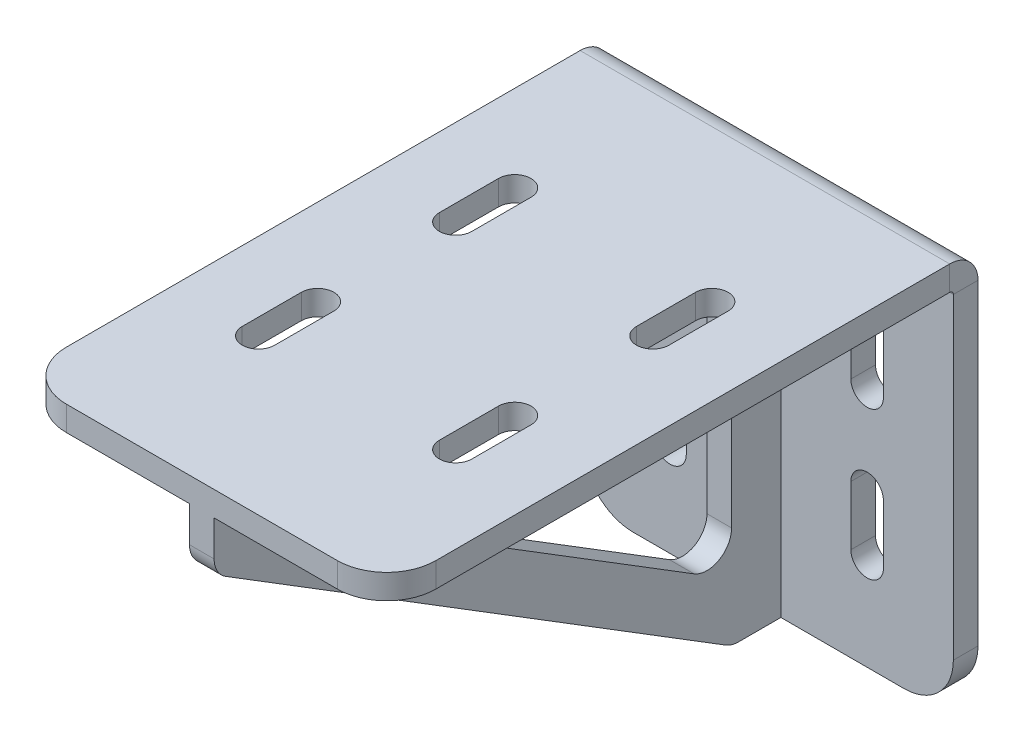
from build123d import *

# Parameters (mm, degrees)
SKETCH_1_W                       = 75
SKETCH_1_H                       = 80
SM_BASE_FLANGE_1_DEPTH           = 5
SM_EDGE_FLANGE_1_STRIP_W         = 21.4732
SM_EDGE_FLANGE_1_STRIP_H         = 5
SM_EDGE_FLANGE_1_STRIP_CUT_DEPTH = 75
SM_EDGE_FLANGE_1_DEPTH           = 75
EXTRUDE_1_DEPTH                  = 2.5
CUT_EXTRUDE_1_DEPTH              = 129.16005618
FILLET_1_R                       = 5
FILLET_2_R                       = 10
CUT_EXTRUDE_2_DEPTH              = 128.401923062
CUT_EXTRUDE_3_DEPTH              = 143.324453275


# Sheet-metal steps are written as plain solids
with BuildPart() as part:
    # Sketch 1 → 基体-法兰1 (new body)
    with BuildSketch(Plane.XY):
        Rectangle(SKETCH_1_W, SKETCH_1_H)
    extrude(amount=-SM_BASE_FLANGE_1_DEPTH)

    # 边线-法兰1 strip (across the edge) → 边线-法兰1 strip cut (cut)
    with BuildSketch(Plane(origin=(37.5, 40, 0), x_dir=(0, -1, 0), z_dir=(-1, 0, 0))):
        with Locations((-5, -2.5)):
            Rectangle(SM_EDGE_FLANGE_1_STRIP_W, SM_EDGE_FLANGE_1_STRIP_H)
    extrude(amount=SM_EDGE_FLANGE_1_STRIP_CUT_DEPTH, mode=Mode.SUBTRACT)

    # 边线-法兰1 section (across the edge) → 边线-法兰1 (add)
    with BuildSketch(Plane(origin=(37.5, 40, 0), x_dir=(0, -1, 0), z_dir=(-1, 0, 0))):
        with BuildLine():
            Line((0, 0.7366), (0, 115))
            Line((0, 115), (5, 115))
            Line((5, 115), (5, 0.7366))
            ThreePointArc((5, 0.7366), (5.215745145, 0.215745145), (5.7366, 0))
            Line((5.7366, 0), (5.7366, -5))
            ThreePointArc((5.7366, -5), (1.680211239, -3.319788761), (0, 0.7366))
        make_face()
    extrude(amount=SM_EDGE_FLANGE_1_DEPTH)

    # 草图9 → 凸台-拉伸1 (add, symmetric)
    with BuildSketch(Plane(origin=(0, 0, 0), x_dir=(0, 0, -1), z_dir=(1, 0, 0))):
        with BuildLine():
            Line((-115, 35), (-115, 25))
            Line((-115, 25), (-10, -40))
            Line((-10, -40), (0, -40))
            Line((0, -40), (0, 34.2634))
            ThreePointArc((0, 34.2634), (-0.215745145, 34.784254855), (-0.7366, 35))
            Line((-0.7366, 35), (-115, 35))
        make_face()
    extrude(amount=EXTRUDE_1_DEPTH, both=True)

    # 草图10 → 切除-拉伸1 (cut, through all)
    with BuildSketch(Plane(origin=(2.5, 0, 0), x_dir=(0, 0, -1), z_dir=(1, 0, 0))):
        Polygon((-10, 25), (-96.001401484, 25), (-10, -28.238962824), align=None)
    extrude(amount=-CUT_EXTRUDE_1_DEPTH, mode=Mode.SUBTRACT)

    # 圆角1
    fillet_1_edges = [part.edges().sort_by_distance(p)[0] for p in [
        (0, 25, 115),
        (0, -40, 10),
        (0, 25, 10),
        (0, -28.238962824, 10),
        (0, 25, 96.001401484),
    ]]
    fillet(fillet_1_edges, radius=FILLET_1_R)

    # 圆角2
    fillet_2_edges = [part.edges().sort_by_distance(p)[0] for p in [
        (37.5, 37.5, 115),
        (-37.5, 37.5, 115),
        (37.5, -40, -2.5),
        (-37.5, -40, -2.5),
    ]]
    fillet(fillet_2_edges, radius=FILLET_2_R)

    # 草图11 → 切除-拉伸2 (cut, through all)
    with BuildSketch(Plane.XY):
        with BuildLine():
            Line((-16.7, -9), (-16.7, -21))
            ThreePointArc((-16.7, -21), (-20, -24.3), (-23.3, -21))
            Line((-23.3, -21), (-23.3, -9))
            ThreePointArc((-23.3, -9), (-20, -5.7), (-16.7, -9))
        make_face()
        with BuildLine():
            Line((-23.3, 9), (-23.3, 21))
            ThreePointArc((-23.3, 21), (-20, 24.3), (-16.7, 21))
            Line((-16.7, 21), (-16.7, 9))
            ThreePointArc((-16.7, 9), (-20, 5.7), (-23.3, 9))
        make_face()
        with BuildLine():
            Line((16.7, 9), (16.7, 21))
            ThreePointArc((16.7, 21), (20, 24.3), (23.3, 21))
            Line((23.3, 21), (23.3, 9))
            ThreePointArc((23.3, 9), (20, 5.7), (16.7, 9))
        make_face()
        with BuildLine():
            Line((23.3, -9), (23.3, -21))
            ThreePointArc((23.3, -21), (20, -24.3), (16.7, -21))
            Line((16.7, -21), (16.7, -9))
            ThreePointArc((16.7, -9), (20, -5.7), (23.3, -9))
        make_face()
    extrude(amount=-CUT_EXTRUDE_2_DEPTH, mode=Mode.SUBTRACT)

    # 草图12 → 切除-拉伸3 (cut, through all)
    with BuildSketch(Plane.XZ.offset(-35)):
        with BuildLine():
            Line((-16.7, 83.5), (-16.7, 71.5))
            ThreePointArc((-16.7, 71.5), (-20, 68.2), (-23.3, 71.5))
            Line((-23.3, 71.5), (-23.3, 83.5))
            ThreePointArc((-23.3, 83.5), (-20, 86.8), (-16.7, 83.5))
        make_face()
        with BuildLine():
            Line((23.3, 83.5), (23.3, 71.5))
            ThreePointArc((23.3, 71.5), (20, 68.2), (16.7, 71.5))
            Line((16.7, 71.5), (16.7, 83.5))
            ThreePointArc((16.7, 83.5), (20, 86.8), (23.3, 83.5))
        make_face()
        with BuildLine():
            Line((16.7, 31.5), (16.7, 43.5))
            ThreePointArc((16.7, 43.5), (20, 46.8), (23.3, 43.5))
            Line((23.3, 43.5), (23.3, 31.5))
            ThreePointArc((23.3, 31.5), (20, 28.2), (16.7, 31.5))
        make_face()
        with BuildLine():
            Line((-23.3, 31.5), (-23.3, 43.5))
            ThreePointArc((-23.3, 43.5), (-20, 46.8), (-16.7, 43.5))
            Line((-16.7, 43.5), (-16.7, 31.5))
            ThreePointArc((-16.7, 31.5), (-20, 28.2), (-23.3, 31.5))
        make_face()
    extrude(amount=-CUT_EXTRUDE_3_DEPTH, mode=Mode.SUBTRACT)


solid = part.part
